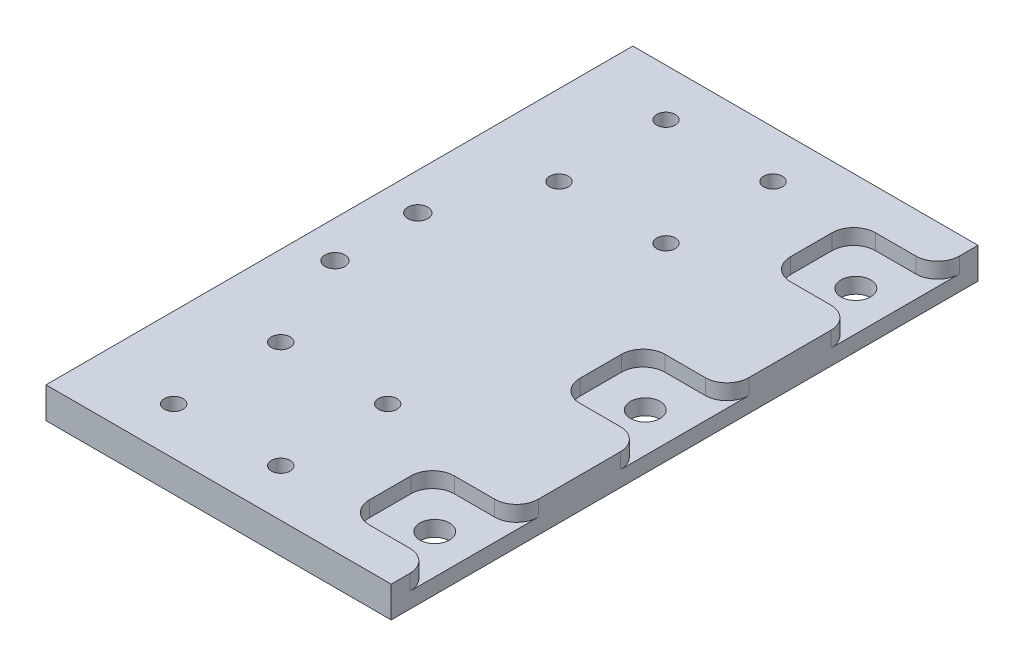
from build123d import *

# Parameters (mm, degrees)
SKETCH1_W                       = 50
SKETCH1_H                       = 95
BOSS_EXTRUDE1_DEPTH             = 2.25
M2_5_CLEARANCE_HOLE1_AT_2_COUNT = 2
M2_5_CLEARANCE_HOLE1_AT_2_PITCH = 15.5
M2_5_CLEARANCE_HOLE1_AT_3_COUNT = 2
M2_5_CLEARANCE_HOLE1_AT_3_PITCH = 21.920310217
M2_5_CLEARANCE_HOLE1_AT_4_COUNT = 2
M2_5_CLEARANCE_HOLE1_AT_4_PITCH = 15.5
SKETCH4_W                       = 50
SKETCH4_H                       = 5
CUT_EXTRUDE1_DEPTH              = 54.865573421
CUT_EXTRUDE2_DEPTH              = 2.25
M4_CLEARANCE_HOLE1_D            = 4.3
M4_CLEARANCE_HOLE1_DEPTH        = 10.1
M4_CLEARANCE_HOLE1_TIP          = 1.291850331
FILLET1_R                       = 3.1524
M2_5_CLEARANCE_HOLE2_D          = 2.9


with BuildPart() as part:
    # Sketch1 → Boss-Extrude1 (new, symmetric)
    with BuildSketch(Plane(origin=(0, 0, 0), x_dir=(1, 0, 0), z_dir=(0, 1, 0))):
        Rectangle(SKETCH1_W, SKETCH1_H)
    extrude(amount=BOSS_EXTRUDE1_DEPTH, both=True)

    # Sketch3 → M2.5 Clearance Hole1 (revolve, cut)
    with BuildSketch(Plane(origin=(2.15, 2.25, 20.15), x_dir=(0, 0, 1), z_dir=(1, 0, 0))):
        Polygon((0, 0), (0, 7.161161836), (1.35, 6.35), (1.35, 0), align=None)
    m2_5_clearance_hole1 = revolve(axis=Axis((2.15, 8.6, 20.15), (0, -1, 0)), mode=Mode.SUBTRACT)

    # M2.5 Clearance Hole1 at 2: M2.5 Clearance Hole1 ×2
    with Locations(*[(0, 0, i * M2_5_CLEARANCE_HOLE1_AT_2_PITCH) for i in range(1, M2_5_CLEARANCE_HOLE1_AT_2_COUNT)]):
        add(m2_5_clearance_hole1, mode=Mode.SUBTRACT)

    # M2.5 Clearance Hole1 at 3: M2.5 Clearance Hole1 ×2
    with Locations(*[Vector(-0.7071067811865477, 0, 0.7071067811865475) * (i * M2_5_CLEARANCE_HOLE1_AT_3_PITCH) for i in range(1, M2_5_CLEARANCE_HOLE1_AT_3_COUNT)]):
        add(m2_5_clearance_hole1, mode=Mode.SUBTRACT)

    # M2.5 Clearance Hole1 at 4: M2.5 Clearance Hole1 ×2
    with Locations(*[(-i * M2_5_CLEARANCE_HOLE1_AT_4_PITCH, 0, 0) for i in range(1, M2_5_CLEARANCE_HOLE1_AT_4_COUNT)]):
        add(m2_5_clearance_hole1, mode=Mode.SUBTRACT)

    # Sketch4 → Cut-Extrude1 (cut, through all)
    with BuildSketch(Plane(origin=(0, 2.25, 0), x_dir=(1, 0, 0), z_dir=(0, 1, 0))):
        with Locations((0, -45)):
            Rectangle(SKETCH4_W, SKETCH4_H)
    cut_extrude1 = extrude(amount=-CUT_EXTRUDE1_DEPTH, mode=Mode.SUBTRACT)

    # Mirror1: M2.5 Clearance Hole1, Cut-Extrude1 across plane
    add(m2_5_clearance_hole1.mirror(Plane.XY), mode=Mode.SUBTRACT)
    add(cut_extrude1.mirror(Plane.XY), mode=Mode.SUBTRACT)

    # Mirror1 copy 1 sketch → Mirror1 copy 1 (revolve, cut)
    with BuildSketch(Plane(origin=(2.15, 2.25, -35.65), x_dir=(0, 0, -1), z_dir=(1, 0, 0))):
        Polygon((0, 0), (0, -7.161161836), (1.35, -6.35), (1.35, 0), align=None)
    revolve(axis=Axis((2.15, 8.6, -35.65), (0, 1, 0)), mode=Mode.SUBTRACT)

    # Mirror1 copy 2 sketch → Mirror1 copy 2 (revolve, cut)
    with BuildSketch(Plane(origin=(-13.35, 2.25, -35.65), x_dir=(0, 0, -1), z_dir=(1, 0, 0))):
        Polygon((0, 0), (0, -7.161161836), (1.35, -6.35), (1.35, 0), align=None)
    revolve(axis=Axis((-13.35, 8.6, -35.65), (0, 1, 0)), mode=Mode.SUBTRACT)

    # Mirror1 copy 3 sketch → Mirror1 copy 3 (revolve, cut)
    with BuildSketch(Plane(origin=(-13.35, 2.25, -20.15), x_dir=(0, 0, -1), z_dir=(1, 0, 0))):
        Polygon((0, 0), (0, -7.161161836), (1.35, -6.35), (1.35, 0), align=None)
    revolve(axis=Axis((-13.35, 8.6, -20.15), (0, 1, 0)), mode=Mode.SUBTRACT)

    # Sketch5 → Cut-Extrude2 (cut)
    with BuildSketch(Plane(origin=(0, 2.25, 0), x_dir=(1, 0, 0), z_dir=(0, 1, 0))):
        with BuildLine():
            Line((25, -36.6524), (16, -36.6524))
            ThreePointArc((16, -36.6524), (13.770916583, -35.729083417), (12.8476, -33.5))
            Line((12.8476, -33.5), (12.8476, -27.5))
            ThreePointArc((12.8476, -27.5), (13.770916583, -25.270916583), (16, -24.3476))
            Line((16, -24.3476), (25, -24.3476))
            Line((25, -24.3476), (25, -36.6524))
        make_face()
        with BuildLine():
            Line((25, 6.1524), (25, -6.1524))
            Line((25, -6.1524), (16, -6.1524))
            ThreePointArc((16, -6.1524), (13.770916583, -5.229083417), (12.8476, -3))
            Line((12.8476, -3), (12.8476, 3))
            ThreePointArc((12.8476, 3), (13.770916583, 5.229083417), (16, 6.1524))
            Line((16, 6.1524), (25, 6.1524))
        make_face()
        with BuildLine():
            Line((25, 36.6524), (25, 24.3476))
            Line((25, 24.3476), (16, 24.3476))
            ThreePointArc((16, 24.3476), (13.770916583, 25.270916583), (12.8476, 27.5))
            Line((12.8476, 27.5), (12.8476, 33.5))
            ThreePointArc((12.8476, 33.5), (13.770916583, 35.729083417), (16, 36.6524))
            Line((16, 36.6524), (25, 36.6524))
        make_face()
    extrude(amount=-CUT_EXTRUDE2_DEPTH, mode=Mode.SUBTRACT)

    # M4 Clearance Hole1
    with Locations(Plane(origin=(0, 0, 0), x_dir=(1, 0, 0), z_dir=(0, 1, 0))):
        with Locations((19.3048, -30.5), (19.3048, 0), (19.3048, 30.5)):
            Hole(M4_CLEARANCE_HOLE1_D / 2, depth=M4_CLEARANCE_HOLE1_DEPTH)
            with Locations((0, 0, -(M4_CLEARANCE_HOLE1_DEPTH + M4_CLEARANCE_HOLE1_TIP / 2))):  # 118° drill point
                Cone(0, M4_CLEARANCE_HOLE1_D / 2, M4_CLEARANCE_HOLE1_TIP, mode=Mode.SUBTRACT)

    # Fillet1
    fillet1_edges = [part.edges().sort_by_distance(p)[0] for p in [
        (25, 1.125, -36.6524),
        (25, 1.125, -24.3476),
        (25, 1.125, -6.1524),
        (25, 1.125, 6.1524),
        (25, 1.125, 24.3476),
        (25, 1.125, 36.6524),
    ]]
    fillet(fillet1_edges, radius=FILLET1_R)

    # M2.5 Clearance Hole2 (through all)
    with Locations(Plane(origin=(0, -2.25, 0), x_dir=(-1, 0, 0), z_dir=(0, -1, 0))):
        with Locations((19.641987941, 6), (19.641987941, -6)):
            Hole(M2_5_CLEARANCE_HOLE2_D / 2)


solid = part.part
